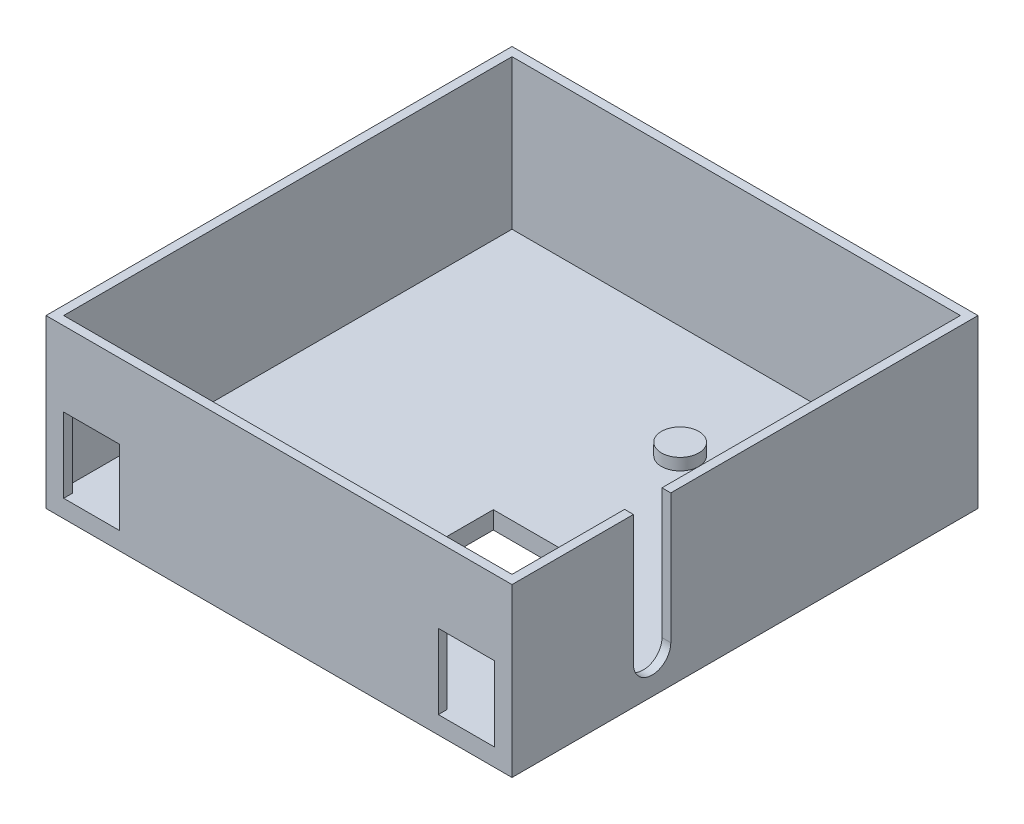
from build123d import *

# Parameters (mm, degrees)
SKETCH1_W           = 79.2
SKETCH1_H           = 79.2
BOSS_EXTRUDE1_DEPTH = 3
SKETCH2_W           = 79.2
SKETCH2_H           = 79.2
SKETCH2_W_2         = 76.2
SKETCH2_H_2         = 76.2
BOSS_EXTRUDE2_DEPTH = 25.4
CUT_EXTRUDE2_DEPTH  = 19.05
SKETCH5_W           = 9.525
SKETCH5_H           = 12.7
CUT_EXTRUDE3_DEPTH  = 19.05
SKETCH6_R           = 3.175
BOSS_EXTRUDE3_DEPTH = 2
SKETCH7_W           = 12.7
SKETCH7_H           = 12.7
CUT_EXTRUDE5_DEPTH  = 26


with BuildPart() as part:
    # Sketch1 → Boss-Extrude1 (new body)
    with BuildSketch(Plane(origin=(0, 0, 0), x_dir=(1, 0, 0), z_dir=(0, 1, 0))):
        Rectangle(SKETCH1_W, SKETCH1_H)
    extrude(amount=BOSS_EXTRUDE1_DEPTH)

    # Sketch2 → Boss-Extrude2 (add)
    with BuildSketch(Plane(origin=(0, 3, 0), x_dir=(1, 0, 0), z_dir=(0, 1, 0))):
        Rectangle(SKETCH2_W, SKETCH2_H)
        Rectangle(SKETCH2_W_2, SKETCH2_H_2, mode=Mode.SUBTRACT)
    extrude(amount=BOSS_EXTRUDE2_DEPTH)

    # Sketch3 → Cut-Extrude2 (cut)
    with BuildSketch(Plane(origin=(39.6, 0, 0), x_dir=(0, 0, -1), z_dir=(1, 0, 0))):
        with BuildLine():
            Line((-18.9625, 28.4), (-18.9625, 6.35))
            ThreePointArc((-18.9625, 6.35), (-15.7875, 3.175), (-12.6125, 6.35))
            Line((-12.6125, 6.35), (-12.6125, 28.4))
            Line((-12.6125, 28.4), (-18.9625, 28.4))
        make_face()
    extrude(amount=-CUT_EXTRUDE2_DEPTH, mode=Mode.SUBTRACT)

    # Sketch5 → Cut-Extrude3 (cut)
    with BuildSketch(Plane.XY.offset(39.6)):
        with Locations((31.8375, 9.35)):
            Rectangle(SKETCH5_W, SKETCH5_H)
        with Locations((-31.8375, 9.35)):
            Rectangle(SKETCH5_W, SKETCH5_H)
    extrude(amount=-CUT_EXTRUDE3_DEPTH, mode=Mode.SUBTRACT)

    # Sketch6 → Boss-Extrude3 (add)
    with BuildSketch(Plane(origin=(0, 3, 0), x_dir=(1, 0, 0), z_dir=(0, 1, 0))):
        with Locations((9.525, 19.05)):
            Circle(SKETCH6_R)
    extrude(amount=BOSS_EXTRUDE3_DEPTH)

    # Sketch7 → Cut-Extrude5 (cut)
    with BuildSketch(Plane(origin=(0, 3, 0), x_dir=(1, 0, 0), z_dir=(0, 1, 0))):
        with Locations((7.9375, -11.1125)):
            Rectangle(SKETCH7_W, SKETCH7_H)
    extrude(amount=-CUT_EXTRUDE5_DEPTH, mode=Mode.SUBTRACT)


solid = part.part
